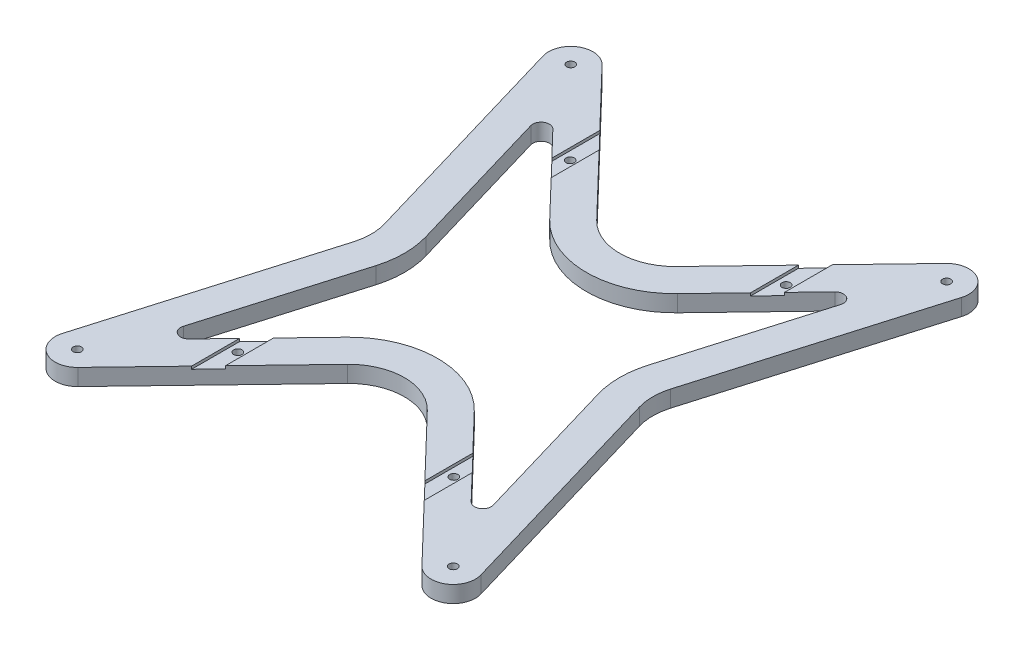
from build123d import *

# Parameters (mm, degrees)
SKETCH1_R           = 1.5
BOSS_EXTRUDE1_DEPTH = 6
FILLET1_R           = 20
CUT_EXTRUDE1_REACH  = 125.376
SKETCH6_W           = 6
SKETCH6_H           = 23.562763172
CUT_EXTRUDE2_DEPTH  = 1
FILLET3_R           = 3


with BuildPart() as part:
    # Sketch1 → Boss-Extrude1 (new body)
    with BuildSketch(Plane(origin=(0, 0, 0), x_dir=(1, 0, 0), z_dir=(0, 1, 0))):
        with BuildLine():
            Line((-62.113867032, 94.638535384), (0, 30))
            Line((0, 30), (62.113867032, 94.638535384))
            ThreePointArc((62.113867032, 94.638535384), (71.897870771, 96.01461607), (75.556778938, 86.83677764))
            Line((75.556778938, 86.83677764), (50, 0))
            Line((50, 0), (75.556778938, -86.83677764))
            ThreePointArc((75.556778938, -86.83677764), (71.897870771, -96.01461607), (62.113867032, -94.638535384))
            Line((62.113867032, -94.638535384), (0, -30))
            Line((0, -30), (-62.113867032, -94.638535384))
            ThreePointArc((-62.113867032, -94.638535384), (-71.897870771, -96.01461607), (-75.556778938, -86.83677764))
            Line((-75.556778938, -86.83677764), (-50, 0))
            Line((-50, 0), (-75.556778938, 86.83677764))
            ThreePointArc((-75.556778938, 86.83677764), (-71.897870771, 96.01461607), (-62.113867032, 94.638535384))
        make_face()
        with Locations((-67.882250994, 89.09545443)):
            Circle(SKETCH1_R, mode=Mode.SUBTRACT)
        with Locations((67.882250994, 89.09545443)):
            Circle(SKETCH1_R, mode=Mode.SUBTRACT)
        with Locations((-67.882250994, -89.09545443)):
            Circle(SKETCH1_R, mode=Mode.SUBTRACT)
        with Locations((67.882250994, -89.09545443)):
            Circle(SKETCH1_R, mode=Mode.SUBTRACT)
        with Locations((-39, 60)):
            Circle(SKETCH1_R, mode=Mode.SUBTRACT)
        with Locations((39, 60)):
            Circle(SKETCH1_R, mode=Mode.SUBTRACT)
        with Locations((39, -60)):
            Circle(SKETCH1_R, mode=Mode.SUBTRACT)
        with Locations((-39, -60)):
            Circle(SKETCH1_R, mode=Mode.SUBTRACT)
    extrude(amount=BOSS_EXTRUDE1_DEPTH)

    # Fillet1
    fillet1_edges = [part.edges().sort_by_distance(p)[0] for p in [
        (0, 3, -30),
        (-50, 3, 0),
        (0, 3, 30),
        (50, 3, 0),
    ]]
    fillet(fillet1_edges, radius=FILLET1_R)

    # Sketch2 → Cut-Extrude1 (cut, up to next)
    with BuildSketch(Plane(origin=(0, 6, 0), x_dir=(1, 0, 0), z_dir=(0, 1, 0)), mode=Mode.PRIVATE) as cut_extrude1_sk1:
        with BuildLine():
            Line((-59.422658043, 74.519051709), (-40.150076044, 9.034707157))
            ThreePointArc((-40.150076044, 9.034707157), (-38.848187819, 0), (-40.150076044, -9.034707157))
            Line((-40.150076044, -9.034707157), (-59.422658043, -74.519051709))
            Line((-59.422658043, -74.519051709), (-23.073535848, -36.69249005))
            ThreePointArc((-23.073535848, -36.69249005), (0, -26.864813867), (23.073535848, -36.69249005))
            Line((23.073535848, -36.69249005), (59.422658043, -74.519051709))
            Line((59.422658043, -74.519051709), (40.150076044, -9.034707157))
            ThreePointArc((40.150076044, -9.034707157), (38.848187819, 0), (40.150076044, 9.034707157))
            Line((40.150076044, 9.034707157), (59.422658043, 74.519051709))
            Line((59.422658043, 74.519051709), (23.073535848, 36.69249005))
            ThreePointArc((23.073535848, 36.69249005), (0, 26.864813867), (-23.073535848, 36.69249005))
            Line((-23.073535848, 36.69249005), (-59.422658043, 74.519051709))
        make_face()
    cut_extrude1_tool1 = extrude(cut_extrude1_sk1.sketch, amount=-CUT_EXTRUDE1_REACH, mode=Mode.PRIVATE) & part.part
    add(cut_extrude1_tool1.solids().sort_by_distance((0, 6, 0))[0], mode=Mode.SUBTRACT)

    # Sketch6 → Cut-Extrude2 (cut)
    with BuildSketch(Plane(origin=(0, 6, 0), x_dir=(1, 0, 0), z_dir=(0, 1, 0))):
        with Locations((-39, -61.925742376)):
            Rectangle(SKETCH6_W, SKETCH6_H)
        with Locations((39, -61.925742376)):
            Rectangle(SKETCH6_W, SKETCH6_H)
        with Locations((39, 61.925742376)):
            Rectangle(SKETCH6_W, SKETCH6_H)
        with Locations((-39, 61.925742376)):
            Rectangle(SKETCH6_W, SKETCH6_H)
    extrude(amount=-CUT_EXTRUDE2_DEPTH, mode=Mode.SUBTRACT)

    # Fillet3
    fillet3_edges = [part.edges().sort_by_distance(p)[0] for p in [
        (59.422658043, 3, 74.519051709),
        (-59.422658043, 3, 74.519051709),
        (59.422658043, 3, -74.519051709),
        (-59.422658043, 3, -74.519051709),
    ]]
    fillet(fillet3_edges, radius=FILLET3_R)


solid = part.part
